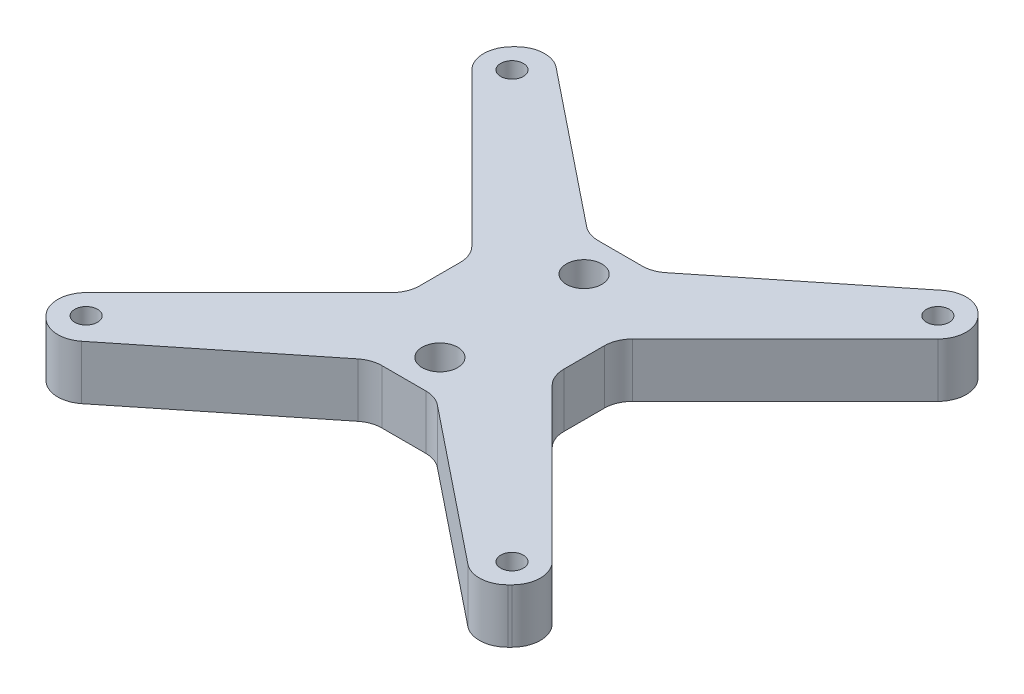
from build123d import *

# Parameters (mm, degrees)
SKETCH1_R           = 2
SKETCH1_R_2         = 3.125
BOSS_EXTRUDE1_DEPTH = 9.525
FILLET1_R           = 5


with BuildPart() as part:
    # Sketch1 → Boss-Extrude1 (new body)
    with BuildSketch(Plane(origin=(0, 0, 0), x_dir=(1, 0, 0), z_dir=(0, 1, 0))):
        Polygon((-12.7, 5.628932188), (-44.571067812, 37.5), (-37.5, 44.571067812), (-5.628932188, 19.05), (5.628932188, 19.05), (37.5, 44.571067812), (44.571067812, 37.5), (12.7, 5.628932188), (12.7, -5.628932188), (44.571067812, -37.5), (37.5, -44.571067812), (5.628932188, -19.05), (-5.628932188, -19.05), (-37.5, -44.571067812), (-44.571067812, -37.5), (-12.7, -5.628932188), align=None)
        with Locations((37.5, 37.5)):
            Circle(SKETCH1_R, mode=Mode.SUBTRACT)
        with Locations((37.5, -37.5)):
            Circle(SKETCH1_R, mode=Mode.SUBTRACT)
        with Locations((-37.5, -37.5)):
            Circle(SKETCH1_R, mode=Mode.SUBTRACT)
        with Locations((-37.5, 37.5)):
            Circle(SKETCH1_R, mode=Mode.SUBTRACT)
        with Locations((0, 12.7)):
            Circle(SKETCH1_R_2, mode=Mode.SUBTRACT)
        with Locations((0, -12.7)):
            Circle(SKETCH1_R_2, mode=Mode.SUBTRACT)
    extrude(amount=BOSS_EXTRUDE1_DEPTH)

    # Fillet1
    fillet1_edges = [part.edges().sort_by_distance(p)[0] for p in [
        (12.7, 4.7625, -5.628932188),
        (12.7, 4.7625, 5.628932188),
        (44.571067812, 4.7625, 37.5),
        (-44.571067812, 4.7625, 37.5),
        (-12.7, 4.7625, 5.628932188),
        (-44.571067812, 4.7625, -37.5),
        (44.571067812, 4.7625, -37.5),
        (-12.7, 4.7625, -5.628932188),
        (5.628932188, 4.7625, 19.05),
        (-5.628932188, 4.7625, 19.05),
        (-37.5, 4.7625, 44.571067812),
        (37.5, 4.7625, 44.571067812),
        (37.5, 4.7625, -44.571067812),
        (5.628932188, 4.7625, -19.05),
        (-5.628932188, 4.7625, -19.05),
        (-37.5, 4.7625, -44.571067812),
    ]]
    fillet(fillet1_edges, radius=FILLET1_R)


solid = part.part
